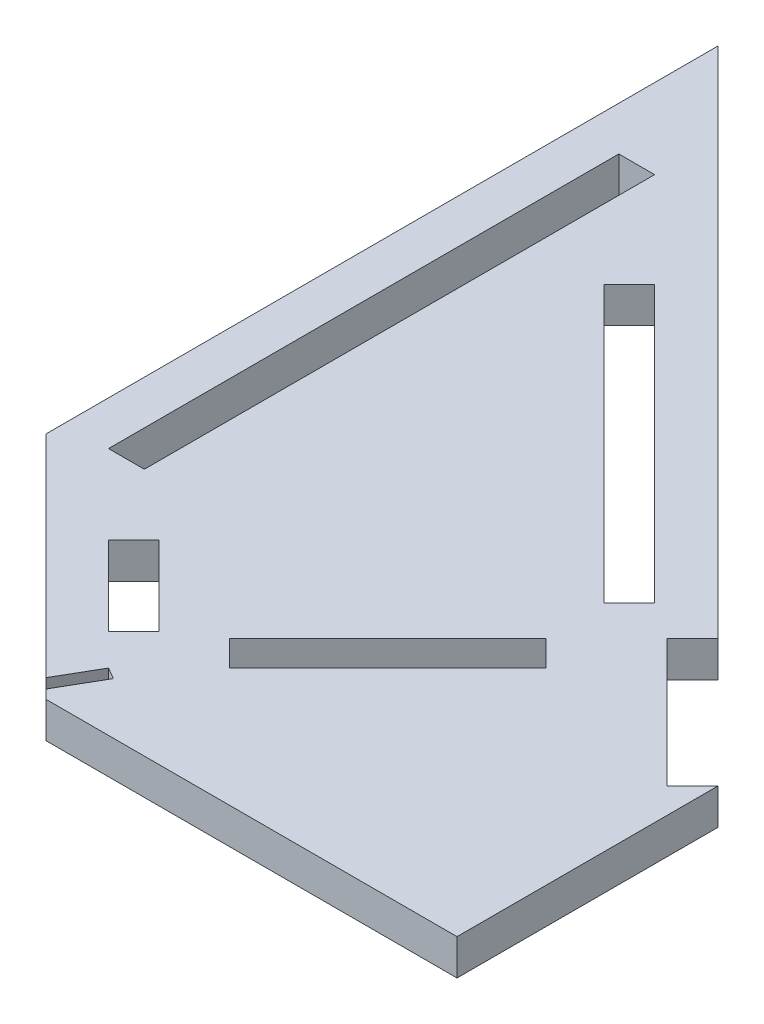
from build123d import *

# Parameters (mm, degrees)
SKETCH1_W           = 8
SKETCH1_H           = 113.93
BOSS_EXTRUDE1_DEPTH = 8


with BuildPart() as part:
    # Sketch1 → Boss-Extrude1 (new body)
    with BuildSketch(Plane(origin=(0, 0, 0), x_dir=(1, 0, 0), z_dir=(0, 1, 0))):
        Polygon((-91.75, 0), (0, 0), (0, 58.25), (-143.078881246, 201.328881246), (-143.078881246, 51.328881246), (-95.946152423, 4.196152423), (-90.845299139, 13.031089472), (-88.247222928, 11.531089472), (-93.75, 2), align=None)
        Polygon((-97.916366951, 20.102157284), (-115.594036481, 37.779826814), (-109.937182231, 43.436681063), (-92.259512701, 25.759011533), align=None, mode=Mode.SUBTRACT)
        Polygon((-77.336028923, 26.540356145), (-82.992883173, 32.197210395), (-47.637544114, 67.552549454), (-41.980689864, 61.895695204), align=None, mode=Mode.SUBTRACT)
        with Locations((-129.27170601, 112.422496343)):
            Rectangle(SKETCH1_W, SKETCH1_H, mode=Mode.SUBTRACT)
        Polygon((-48.083929776, 80.88601161), (-109.715356824, 142.517438658), (-104.058502575, 148.174292908), (-42.427075526, 86.542865859), align=None, mode=Mode.SUBTRACT)
        Polygon((-5.660150048, 52.593705498), (-34.128269059, 81.061824509), (-28.471414809, 86.718678758), (-0.003295799, 58.250559747), align=None, mode=Mode.SUBTRACT)
    extrude(amount=BOSS_EXTRUDE1_DEPTH)


solid = part.part
